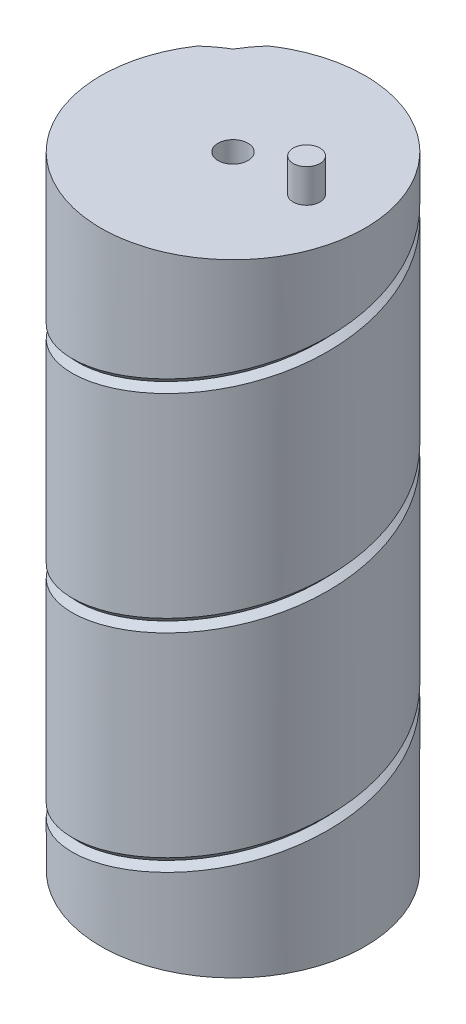
from build123d import *

# Parameters (mm, degrees)
SKETCH1_2_R                  = 19.75
EXTRUDE_MAIN_BODY_DEPTH      = 93
CUT_ANTENNA_WIRE_GUIDE_PITCH = 31
SKETCH28_R                   = 2
BOSS_EXTRUDE3_DEPTH          = 5
F_8_CLEARANCE_HOLE1_D        = 4.4958
SKETCH31_R                   = 2.25
CUT_EXTRUDE1_DEPTH           = 5.5


with BuildPart() as part:
    # Sketch1<2> → Extrude - Main Body (new body)
    with BuildSketch(Plane(origin=(0, 0, 0), x_dir=(1, 0, 0), z_dir=(0, 1, 0))):
        with Locations(Location((0, 0, 0), (0, 0, 90))):
            Circle(SKETCH1_2_R)
    extrude(amount=EXTRUDE_MAIN_BODY_DEPTH)

    # Cut - Antenna Wire Guide: arcs per turn and ends read off the stored shape
    # Cut - Antenna Wire Guide: the profile of Sketch15 screwed along a right-hand helix through 4.5 turns, 24 arcs to a turn; built about Z, then put on its axis
    cut_antenna_wire_guide_z = Axis((0, 0, 0), (0, 0, 1))
    cut_antenna_wire_guide_corners = [(19.75, 0, -31), (19.75, 0.222791045, -31.891831907), (18.830761184, 0, -31), (19.75, -0.222791045, -30.108168093)]
    with BuildLine(mode=Mode.PRIVATE) as cut_antenna_wire_guide_profile:
        Line(cut_antenna_wire_guide_corners[0], cut_antenna_wire_guide_corners[1])
        Line(cut_antenna_wire_guide_corners[1], cut_antenna_wire_guide_corners[2])
        Line(cut_antenna_wire_guide_corners[2], cut_antenna_wire_guide_corners[3])
        Line(cut_antenna_wire_guide_corners[3], cut_antenna_wire_guide_corners[0])
    cut_antenna_wire_guide_cap = Face(cut_antenna_wire_guide_profile.wire())
    cut_antenna_wire_guide_turn_angles = [0, 7.5, 15, 22.5, 30, 37.5, 45, 52.5, 60, 67.5, 75, 82.5, 90, 97.5, 105, 112.5, 120, 127.5, 135, 142.5, 150, 157.5, 165, 172.5, 180, 187.5, 195, 202.5, 210, 217.5, 225, 232.5, 240, 247.5, 255, 262.5, 270, 277.5, 285, 292.5, 300, 307.5, 315, 322.5, 330, 337.5, 345, 352.5, 360]
    cut_antenna_wire_guide_turn_weights = [1, 0.9914448613738104, 1, 0.9914448613738104, 1, 0.9914448613738104, 1, 0.9914448613738104, 1, 0.9914448613738104, 1, 0.9914448613738104, 1, 0.9914448613738104, 1, 0.9914448613738104, 1, 0.9914448613738104, 1, 0.9914448613738104, 1, 0.9914448613738104, 1, 0.9914448613738104, 1, 0.9914448613738104, 1, 0.9914448613738104, 1, 0.9914448613738104, 1, 0.9914448613738104, 1, 0.9914448613738104, 1, 0.9914448613738104, 1, 0.9914448613738104, 1, 0.9914448613738104, 1, 0.9914448613738104, 1, 0.9914448613738104, 1, 0.9914448613738104, 1, 0.9914448613738104, 1]
    cut_antenna_wire_guide_turn_rails = [Edge.make_bspline([Vector(p[0], p[1], 0).rotate(cut_antenna_wire_guide_z, cut_antenna_wire_guide_turn_angles[k]) / cut_antenna_wire_guide_turn_weights[k] + Vector(0, 0, p[2] + CUT_ANTENNA_WIRE_GUIDE_PITCH * cut_antenna_wire_guide_turn_angles[k] / 360) for k in range(49)], [0, 0, 0, 1, 1, 2, 2, 3, 3, 4, 4, 5, 5, 6, 6, 7, 7, 8, 8, 9, 9, 10, 10, 11, 11, 12, 12, 13, 13, 14, 14, 15, 15, 16, 16, 17, 17, 18, 18, 19, 19, 20, 20, 21, 21, 22, 22, 23, 23, 24, 24, 24], 2, cut_antenna_wire_guide_turn_weights) for p in cut_antenna_wire_guide_corners]
    cut_antenna_wire_guide_turn_sides = [Face.make_surface_from_curves(cut_antenna_wire_guide_turn_rails[p[0]], cut_antenna_wire_guide_turn_rails[p[1]]) for p in [(0, 1), (1, 2), (2, 3), (3, 0)]]
    cut_antenna_wire_guide_last_angles = [1440, 1447.5, 1455, 1462.5, 1470, 1477.5, 1485, 1492.5, 1500, 1507.5, 1515, 1522.5, 1530, 1537.5, 1545, 1552.5, 1560, 1567.5, 1575, 1582.5, 1590, 1597.5, 1605, 1612.5, 1620]
    cut_antenna_wire_guide_last_weights = [1, 0.9914448613738104, 1, 0.9914448613738104, 1, 0.9914448613738104, 1, 0.9914448613738104, 1, 0.9914448613738104, 1, 0.9914448613738104, 1, 0.9914448613738104, 1, 0.9914448613738104, 1, 0.9914448613738104, 1, 0.9914448613738104, 1, 0.9914448613738104, 1, 0.9914448613738104, 1]
    cut_antenna_wire_guide_last_rails = [Edge.make_bspline([Vector(p[0], p[1], 0).rotate(cut_antenna_wire_guide_z, cut_antenna_wire_guide_last_angles[k]) / cut_antenna_wire_guide_last_weights[k] + Vector(0, 0, p[2] + CUT_ANTENNA_WIRE_GUIDE_PITCH * cut_antenna_wire_guide_last_angles[k] / 360) for k in range(25)], [0, 0, 0, 1, 1, 2, 2, 3, 3, 4, 4, 5, 5, 6, 6, 7, 7, 8, 8, 9, 9, 10, 10, 11, 11, 12, 12, 12], 2, cut_antenna_wire_guide_last_weights) for p in cut_antenna_wire_guide_corners]
    cut_antenna_wire_guide_last_sides = [Face.make_surface_from_curves(cut_antenna_wire_guide_last_rails[p[0]], cut_antenna_wire_guide_last_rails[p[1]]) for p in [(0, 1), (1, 2), (2, 3), (3, 0)]]
    cut_antenna_wire_guide = Plane(origin=(0, 0, 0), x_dir=(-0.7071067811865537, 0, -0.7071067811865414), z_dir=(0, 1, 0)) * Solid(Shell([*[p.moved(Location((0, 0, CUT_ANTENNA_WIRE_GUIDE_PITCH * i))) for i in range(4) for p in cut_antenna_wire_guide_turn_sides], *cut_antenna_wire_guide_last_sides, cut_antenna_wire_guide_cap, cut_antenna_wire_guide_cap.rotate(cut_antenna_wire_guide_z, 1620).moved(Location((0, 0, CUT_ANTENNA_WIRE_GUIDE_PITCH * 1620 / 360)))]))
    add(cut_antenna_wire_guide, mode=Mode.SUBTRACT)

    # Sketch28 → Boss-Extrude3 (add)
    with BuildSketch(Plane(origin=(0, 93, 0), x_dir=(1, 0, 0), z_dir=(0, 1, 0))):
        with Locations(Location((11, 0, 0), (0, 0, 270))):
            Circle(SKETCH28_R)
    extrude(amount=BOSS_EXTRUDE3_DEPTH)

    # #8 Clearance Hole1 (through all)
    with Locations(Plane(origin=(0, 93, 0), x_dir=(1, 0, 0), z_dir=(0, 1, 0))):
        with Locations((0, 0)):
            Hole(F_8_CLEARANCE_HOLE1_D / 2)

    # Sketch31 → Cut-Extrude1 (cut)
    with BuildSketch(Plane.XZ):
        with Locations(Location((11, 0, 0), (0, 0, 270))):
            Circle(SKETCH31_R)
    extrude(amount=-CUT_EXTRUDE1_DEPTH, mode=Mode.SUBTRACT)


solid = part.part
